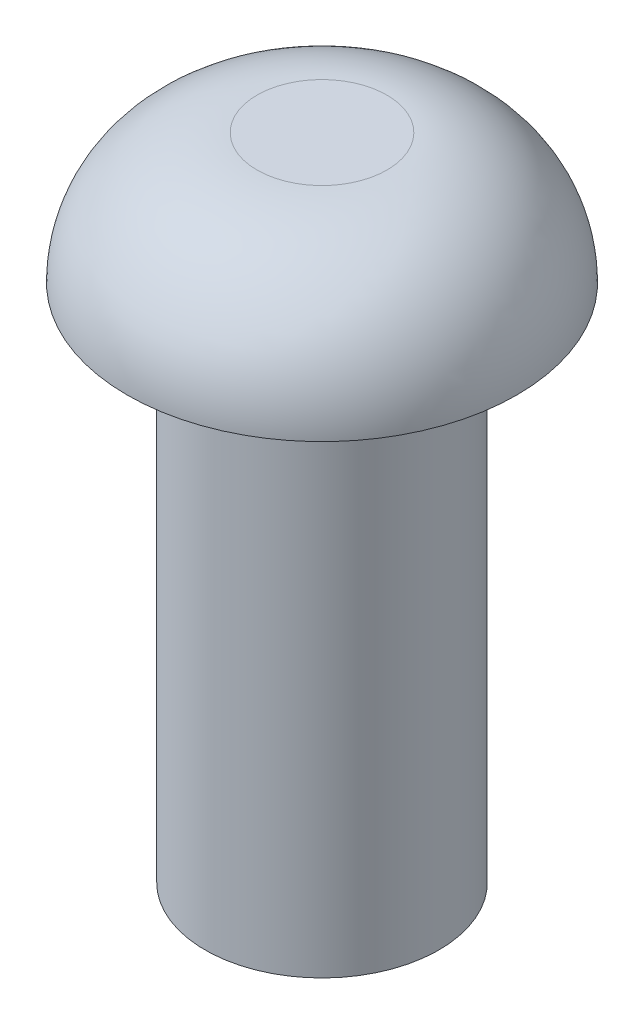
from build123d import *

# Parameters (mm, degrees)
SKETCH1_R           = 150
BOSS_EXTRUDE1_DEPTH = 500
SKETCH2_R           = 150
SKETCH2_R_2         = 90
CUT_EXTRUDE1_DEPTH  = 400
FILLET1_R           = 100


with BuildPart() as part:
    # Sketch1 → Boss-Extrude1 (new body)
    with BuildSketch(Plane(origin=(0, 0, 0), x_dir=(1, 0, 0), z_dir=(0, 1, 0))):
        with Locations(Location((0, 0, 0), (0, 0, 270))):
            Circle(SKETCH1_R)
    extrude(amount=BOSS_EXTRUDE1_DEPTH)

    # Sketch2 → Cut-Extrude1 (cut)
    with BuildSketch(Plane.XZ):
        with Locations(Location((0, 0, 0), (0, 0, 270))):
            Circle(SKETCH2_R)
        with Locations(Location((0, 0, 0), (0, 0, 270))):
            Circle(SKETCH2_R_2, mode=Mode.SUBTRACT)
    extrude(amount=-CUT_EXTRUDE1_DEPTH, mode=Mode.SUBTRACT)

    # Fillet1
    fillet1_edges = [part.edges().sort_by_distance(p)[0] for p in [
        (0, 500, -150),
    ]]
    fillet(fillet1_edges, radius=FILLET1_R - 0.0001)  # a hair under: the kernel refuses the full size


solid = part.part
